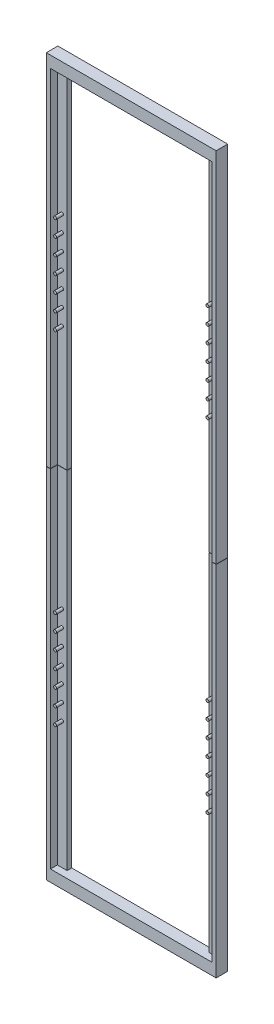
from build123d import *

# Parameters (mm, degrees)
SKETCH1_W           = 310
SKETCH1_H           = 73.5
SKETCH1_W_2         = 300
SKETCH1_H_2         = 61.5
BOSS_EXTRUDE1_DEPTH = 5
SKETCH2_W           = 4.2
SKETCH2_H           = 300
CUT_EXTRUDE1_DEPTH  = 3
SKETCH7_R           = 0.65
BOSS_EXTRUDE2_DEPTH = 3
SKETCH9_W           = 73.5
SKETCH9_H           = 0.1
CUT_EXTRUDE2_DEPTH  = 160.375539215


with BuildPart() as part:
    # Sketch1 → Boss-Extrude1 (new body)
    with BuildSketch(Plane(origin=(0, 0, 0), x_dir=(0, 1, 0), z_dir=(0, 0, 1))):
        Rectangle(SKETCH1_W, SKETCH1_H)
        Rectangle(SKETCH1_W_2, SKETCH1_H_2, mode=Mode.SUBTRACT)
    extrude(amount=BOSS_EXTRUDE1_DEPTH)

    # Sketch2 → Cut-Extrude1 (cut)
    with BuildSketch(Plane.XY.offset(5)):
        with Locations((-32.85, 0)):
            Rectangle(SKETCH2_W, SKETCH2_H)
        with Locations((32.85, 0)):
            Rectangle(SKETCH2_W, SKETCH2_H)
    extrude(amount=-CUT_EXTRUDE1_DEPTH, mode=Mode.SUBTRACT)

    # Sketch7 → Boss-Extrude2 (add)
    with BuildSketch(Plane.XY.offset(2)):
        with Locations((-32.95, -67)):
            Circle(SKETCH7_R)
        with Locations((-32.95, -53)):
            Circle(SKETCH7_R)
        with Locations((-32.95, 53)):
            Circle(SKETCH7_R)
        with Locations((-32.95, 67)):
            Circle(SKETCH7_R)
        with Locations((32.95, 67)):
            Circle(SKETCH7_R)
        with Locations((32.95, 53)):
            Circle(SKETCH7_R)
        with Locations((32.95, -53)):
            Circle(SKETCH7_R)
        with Locations((32.95, -67)):
            Circle(SKETCH7_R)
        with Locations((32.95, -60)):
            Circle(SKETCH7_R)
        with Locations((32.95, -74)):
            Circle(SKETCH7_R)
        with Locations((32.95, -81)):
            Circle(SKETCH7_R)
        with Locations((32.95, -88)):
            Circle(SKETCH7_R)
        with Locations((32.95, -95)):
            Circle(SKETCH7_R)
        with Locations((-32.95, -74)):
            Circle(SKETCH7_R)
        with Locations((-32.95, -60)):
            Circle(SKETCH7_R)
        with Locations((-32.95, -81)):
            Circle(SKETCH7_R)
        with Locations((-32.95, -88)):
            Circle(SKETCH7_R)
        with Locations((-32.95, -95)):
            Circle(SKETCH7_R)
        with Locations((-32.95, 74)):
            Circle(SKETCH7_R)
        with Locations((-32.95, 60)):
            Circle(SKETCH7_R)
        with Locations((-32.95, 81)):
            Circle(SKETCH7_R)
        with Locations((-32.95, 88)):
            Circle(SKETCH7_R)
        with Locations((-32.95, 95)):
            Circle(SKETCH7_R)
        with Locations((32.95, 60)):
            Circle(SKETCH7_R)
        with Locations((32.95, 74)):
            Circle(SKETCH7_R)
        with Locations((32.95, 81)):
            Circle(SKETCH7_R)
        with Locations((32.95, 88)):
            Circle(SKETCH7_R)
        with Locations((32.95, 95)):
            Circle(SKETCH7_R)
    extrude(amount=BOSS_EXTRUDE2_DEPTH)

    # Sketch9 → Cut-Extrude2 (cut, through all)
    with BuildSketch(Plane.XY.offset(5)):
        Rectangle(SKETCH9_W, SKETCH9_H)
    extrude(amount=-CUT_EXTRUDE2_DEPTH, mode=Mode.SUBTRACT)


with BuildPart() as cut_extrude2_piece_1:
    # of the separate pieces the step leaves, piece 1, a body of its own (cut_extrude2_pieces)
    add(part.part.solids().sort_by_distance((36.75, 0.05, 0))[0])


with BuildPart() as cut_extrude2_piece_2:
    # of the separate pieces the step leaves, piece 2, a body of its own (cut_extrude2_pieces)
    add(part.part.solids().sort_by_distance((36.75, -155, 0))[0])


solid = Compound([cut_extrude2_piece_1.part, cut_extrude2_piece_2.part])
